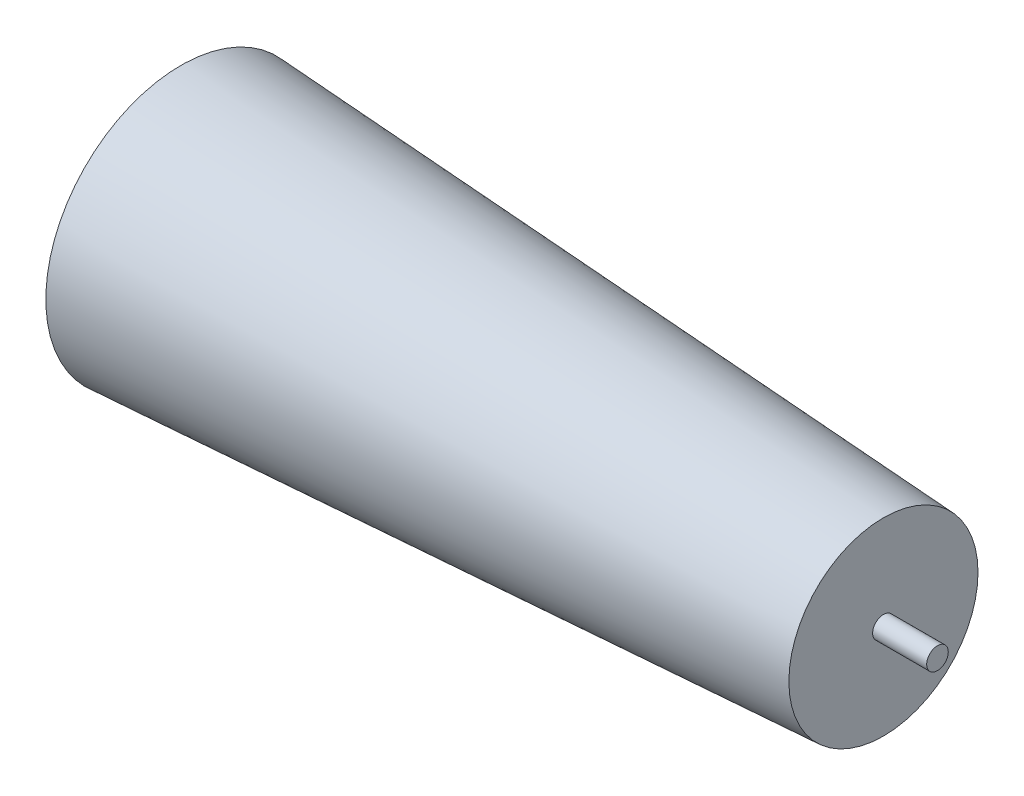
from build123d import *

# Parameters (mm, degrees)
SKETCH1_R                = 50
SKETCH2_R                = 35
BOSS_EXTRUDE1_DEPTH      = 20
BOSS_EXTRUDE1_DEPTH_BACK = 280
SKETCH3_R                = 4


with BuildPart() as part:
    # Sketch1 → Loft1 section 0
    with BuildSketch(Plane(origin=(0, 0, 0), x_dir=(0, 0, -1), z_dir=(1, 0, 0))):
        Circle(SKETCH1_R)
    # Sketch2 → Loft1 section 1
    with BuildSketch(Plane(origin=(260, 0, 0), x_dir=(0, 0, -1), z_dir=(1, 0, 0))):
        Circle(SKETCH2_R)
    loft()

    # Sketch3 → Boss-Extrude1 (add, two sides: drawn at the far end of the back side and taken through both)
    with BuildSketch(Plane(origin=(260, 0, 0), x_dir=(0, 0, -1), z_dir=(1, 0, 0)).offset(-BOSS_EXTRUDE1_DEPTH_BACK)):
        Circle(SKETCH3_R)
    extrude(amount=BOSS_EXTRUDE1_DEPTH + BOSS_EXTRUDE1_DEPTH_BACK)


solid = part.part
